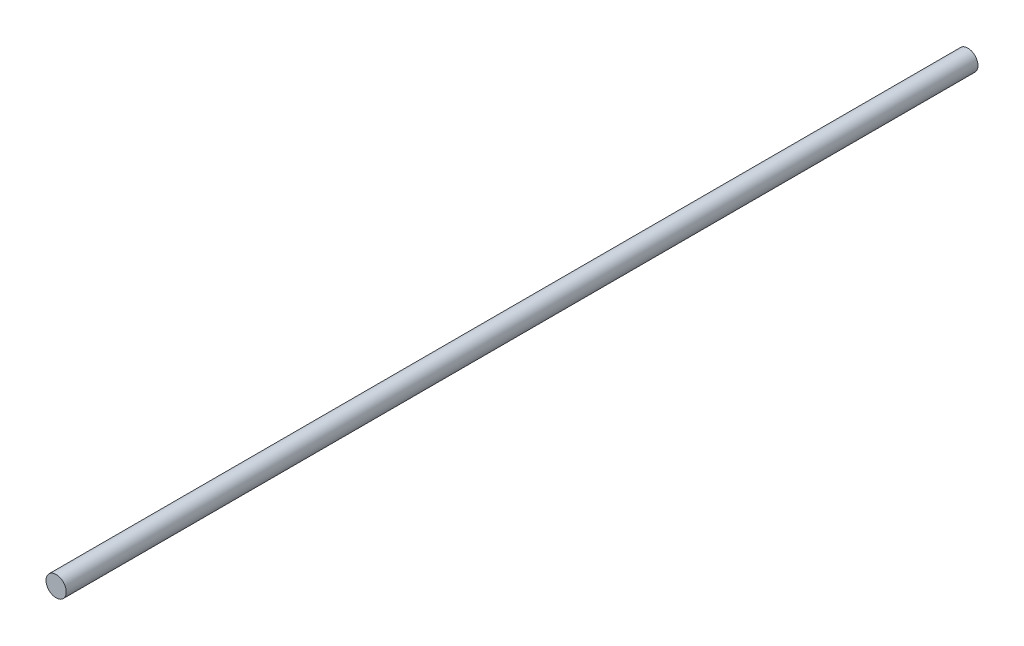
from build123d import *

# Parameters (mm, degrees)
EXTRUDE_1_DEPTH      = 225
EXTRUDE_1_DEPTH_BACK = 225
SKETCH_1_R           = 5


with BuildPart() as part:
    # Эскиз1 → Выдавливание1 (new, two sides: drawn at the far end of the back side and taken through both)
    with BuildSketch(Plane.XY.offset(-EXTRUDE_1_DEPTH_BACK)):
        Circle(SKETCH_1_R)
    extrude(amount=EXTRUDE_1_DEPTH + EXTRUDE_1_DEPTH_BACK)


solid = part.part
